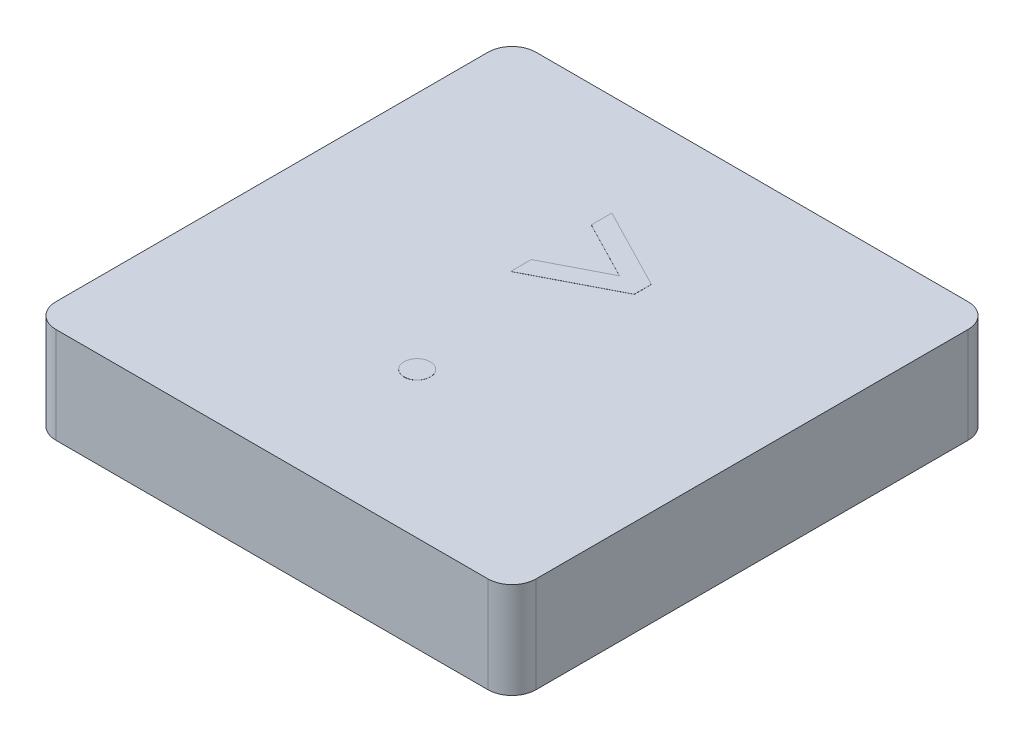
from build123d import *

# Parameters (mm, degrees)
SKETCH1_W           = 12.7
SKETCH1_H           = 12.7
BOSS_EXTRUDE1_DEPTH = 2.54
FILLET1_R           = 0.635
SHELL1_START        = 0.635
SHELL1_OUTLINE_W    = 1.905
SHELL1_OUTLINE_H    = 11.43
SHELL1_DEPTH        = 11.43
SKETCH2_R           = 2.54
BOSS_EXTRUDE2_DEPTH = 1.905
BOSS_EXTRUDE3_DEPTH = 0.00254


# Read off the part's stored shape, not the designer's step: Shell1
with BuildPart() as part:
    # Sketch1 → Boss-Extrude1 (new body)
    with BuildSketch(Plane(origin=(0, 0, 0), x_dir=(1, 0, 0), z_dir=(0, 1, 0))):
        with Locations((6.35, 6.35)):
            Rectangle(SKETCH1_W, SKETCH1_H)
    extrude(amount=BOSS_EXTRUDE1_DEPTH)

    # Fillet1
    fillet1_edges = [part.edges().sort_by_distance(p)[0] for p in [
        (0, 1.27, -12.7),
        (12.7, 1.27, -12.7),
        (12.7, 1.27, 0),
        (0, 1.27, 0),
    ]]
    fillet(fillet1_edges, radius=FILLET1_R)

    # Shell1 outline → Shell1 (cut)
    with BuildSketch(Plane.YZ.offset(SHELL1_START)):
        with Locations((0.9525, -6.35)):
            Rectangle(SHELL1_OUTLINE_W, SHELL1_OUTLINE_H)
    extrude(amount=SHELL1_DEPTH, mode=Mode.SUBTRACT)

    # Sketch2 → Boss-Extrude2 (add)
    with BuildSketch(Plane(origin=(0, 1.905, 0), x_dir=(-1, 0, 0), z_dir=(0, -1, 0))):
        with Locations(Location((-6.35, 6.35, 0), (0, 0, 270))):
            Circle(SKETCH2_R)
    extrude(amount=BOSS_EXTRUDE2_DEPTH)

    # Sketch3 → Boss-Extrude3 (add)
    with BuildSketch(Plane(origin=(0, 2.54, 0), x_dir=(1, 0, 0), z_dir=(0, 1, 0))):
        Polygon((5.324230769, 9.472897436), (5.324230769, 10.017328526), (7.481602564, 8.904933694), (7.481602564, 8.453361178), (5.324230769, 7.341602364), (5.324230769, 7.885397436), (6.864029447, 8.679147436), align=None)
        with BuildLine():
            add(Edge.make_bspline(
                [(6.330624359, 4.207282051), (6.353629408, 4.20602074), (6.398922375, 4.203537435), (6.464364538, 4.185004793), (6.523426467, 4.15170826), (6.576235723, 4.108278705), (6.620889899, 4.056027151), (6.653164929, 3.996440642), (6.673263399, 3.931250637), (6.675482284, 3.885815172), (6.676617949, 3.862560497)],
                knots=[0, 0, 0, 0, 1.016957001, 2.002212695, 2.9757545, 3.99499976, 5.013036768, 5.994806404, 6.97370641, 8, 8, 8, 8], degree=3))
            add(Edge.make_bspline(
                [(6.676617949, 3.862560497), (6.675489724, 3.839302087), (6.673285374, 3.793859325), (6.653025849, 3.728542292), (6.620938129, 3.668466037), (6.57623214, 3.615654573), (6.523645168, 3.571406547), (6.464228744, 3.538417057), (6.399047041, 3.518833105), (6.35365135, 3.51648563), (6.330624359, 3.515294872)],
                knots=[0, 0, 0, 0, 1.023218912, 1.999186227, 2.986238111, 4.008388923, 5.030539734, 6.0011649, 6.986089706, 8, 8, 8, 8], degree=3))
            add(Edge.make_bspline(
                [(6.330624359, 3.515294872), (6.307591911, 3.516475947), (6.262185464, 3.518804333), (6.196902441, 3.538582131), (6.137047359, 3.571186296), (6.084447174, 3.615708246), (6.039541459, 3.668279027), (6.008366022, 3.728731843), (5.987917785, 3.793834699), (5.985743571, 3.83929375), (5.984630769, 3.862560497)],
                knots=[0, 0, 0, 0, 1.013427518, 1.99788335, 2.976245624, 3.997909735, 5.019573847, 6.001765691, 6.977268297, 8, 8, 8, 8], degree=3))
            add(Edge.make_bspline(
                [(5.984630769, 3.862560497), (5.985750912, 3.885823654), (5.987939471, 3.931275691), (6.008227339, 3.996248907), (6.039591423, 4.056215177), (6.084443429, 4.10822492), (6.137267187, 4.151926791), (6.196765885, 4.184841981), (6.262310067, 4.20356642), (6.307613828, 4.206030503), (6.330624359, 4.207282051)],
                knots=[0, 0, 0, 0, 1.025808215, 2.00424526, 2.981110158, 3.998665696, 5.017428914, 5.998734231, 6.983523959, 8, 8, 8, 8], degree=3))
        make_face()
    extrude(amount=BOSS_EXTRUDE3_DEPTH)


solid = part.part
